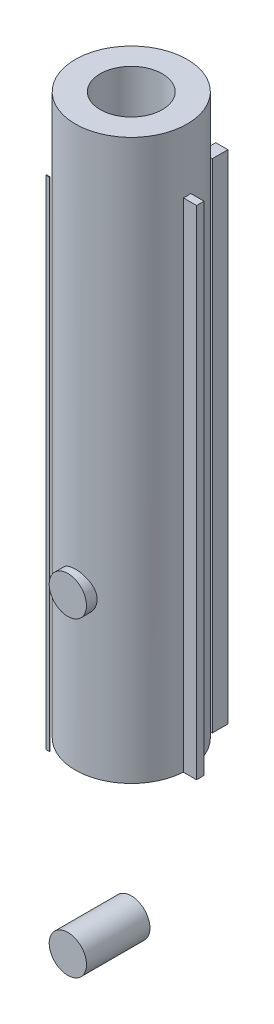
from build123d import *

# Parameters (mm, degrees)
SKETCH1_R           = 9000
SKETCH1_R_2         = 5000
BOSS_EXTRUDE1_DEPTH = 90000
SKETCH2_W           = 2700
SKETCH2_H           = 1200
SKETCH2_W_2         = 1950
SKETCH2_H_2         = 2499.038105677
SKETCH2_W_3         = 554.933921705
SKETCH2_H_3         = 2351.014846027
SKETCH2_W_4         = 300
SKETCH2_H_4         = 99.038105677
BOSS_EXTRUDE2_DEPTH = 80000
SKETCH3_R           = 3000
BOSS_EXTRUDE3_DEPTH = 10200


with BuildPart() as part:
    # Sketch1 → Boss-Extrude1 (new body)
    with BuildSketch(Plane(origin=(0, 0, 0), x_dir=(1, 0, 0), z_dir=(0, 1, 0))):
        Circle(SKETCH1_R)
        Circle(SKETCH1_R_2, mode=Mode.SUBTRACT)
    extrude(amount=BOSS_EXTRUDE1_DEPTH)

    # Sketch2 → Boss-Extrude2 (add)
    with BuildSketch(Plane(origin=(0, 0, 0), x_dir=(1, 0, 0), z_dir=(0, 1, 0))):
        with Locations((9750, 0)):
            Rectangle(SKETCH2_W, SKETCH2_H)
        with Locations((4875, 8443.747686898)):
            Rectangle(SKETCH2_W_2, SKETCH2_H_2)
        with Locations((-4927.466960853, 8517.759316724)):
            Rectangle(SKETCH2_W_3, SKETCH2_H_3)
        with Locations((-9750, 0)):
            Rectangle(SKETCH2_W_4, SKETCH2_H)
        with Locations((-4927.466960853, -8443.747686898)):
            Rectangle(SKETCH2_W_3, SKETCH2_H_4)
    extrude(amount=BOSS_EXTRUDE2_DEPTH)


with BuildPart() as boss_extrude2_piece_1:
    # of the separate pieces the step leaves, piece 1, a body of its own (boss_extrude2_pieces)
    add(part.part.solids().sort_by_distance((8979.977728257, 0, 600))[0])

    # Sketch3 → Boss-Extrude3 (add)
    with BuildSketch(Plane.XY):
        with Locations((0, 25000)):
            Circle(SKETCH3_R)
        with Locations((0, -25000)):
            Circle(SKETCH3_R)
    extrude(amount=BOSS_EXTRUDE3_DEPTH)


with BuildPart() as boss_extrude2_piece_2:
    # of the separate pieces the step leaves, piece 2, a body of its own (boss_extrude2_pieces)
    add(part.part.solids().sort_by_distance((-9600, 0, 600))[0])


with BuildPart() as boss_extrude2_piece_3:
    # of the separate pieces the step leaves, piece 3, a body of its own (boss_extrude2_pieces)
    add(part.part.solids().sort_by_distance((-5204.933921705, 0, 8394.22863406))[0])


with BuildPart() as boss_extrude3_piece_1:
    # of the separate pieces the step leaves, piece 1, a body of its own (boss_extrude3_pieces)
    add(boss_extrude2_piece_1.part.solids().sort_by_distance((8979.977728257, 0, 600))[0])


with BuildPart() as boss_extrude3_piece_2:
    # of the separate pieces the step leaves, piece 2, a body of its own (boss_extrude3_pieces)
    add(boss_extrude2_piece_1.part.solids().sort_by_distance((3000, -25000, 0))[0])


solid = Compound([boss_extrude2_piece_2.part, boss_extrude2_piece_3.part, boss_extrude3_piece_1.part, boss_extrude3_piece_2.part])
